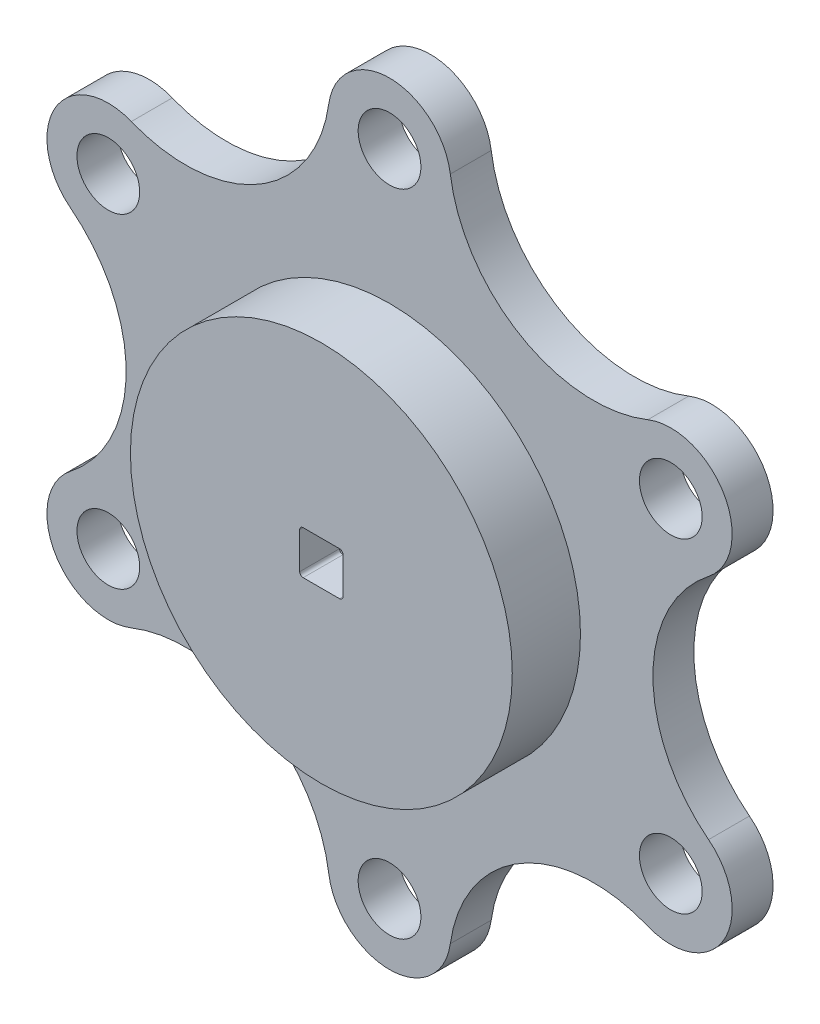
from build123d import *

# Parameters (mm, degrees)
SKETCH1_R           = 2.3
BOSS_EXTRUDE1_DEPTH = 3
SKETCH2_R           = 14
BOSS_EXTRUDE2_DEPTH = 5
CUT_EXTRUDE1_REACH  = 40.688
SKETCH3_W           = 3.175
SKETCH3_H           = 3.175
SKETCH3_3_R         = 5.08
SKETCH3_3_W         = 6.35
SKETCH3_3_H         = 6.35
SKETCH3_3_W_2       = 3.175
SKETCH3_3_H_2       = 3.175
CUT_EXTRUDE2_DEPTH  = 1.27
CUT_EXTRUDE3_START  = -1.27
SKETCH3_4_W         = 6.35
SKETCH3_4_H         = 6.35
SKETCH3_4_W_2       = 3.175
SKETCH3_4_H_2       = 3.175
CUT_EXTRUDE3_DEPTH  = 3.81
FILLET1_R           = 0.254
FILLET2_R           = 0.635


with BuildPart() as part:
    # Sketch1 → Boss-Extrude1 (new body)
    with BuildSketch(Plane.XY):
        with BuildLine():
            ThreePointArc((4.456432387, 24.437168219), (-4.5e-08, 28.3125), (-4.456432399, 24.43716813))
            ThreePointArc((-4.456432399, 24.43716813), (-9.656250022, 16.725115598), (-18.934992245, 16.077967752))
            ThreePointArc((-18.934992245, 16.077967752), (-24.519343502, 14.156251286), (-23.391426978, 8.359202257))
            ThreePointArc((-23.391426978, 8.359202257), (-19.3125, 3.465e-06), (-23.391421517, -8.359197993))
            ThreePointArc((-23.391421517, -8.359197993), (-24.519344633, -14.156249327), (-18.934990017, -16.077966851))
            ThreePointArc((-18.934990017, -16.077966851), (-9.65625113, -16.725114958), (-4.456433088, -24.437163215))
            ThreePointArc((-4.456433088, -24.437163215), (-2.557e-06, -28.3125), (4.456432378, -24.437168281))
            ThreePointArc((4.456432378, -24.437168281), (9.656248045, -16.725116739), (18.934988153, -16.077966097))
            ThreePointArc((18.934988153, -16.077966097), (24.519343112, -14.156251962), (23.391424728, -8.3592005))
            ThreePointArc((23.391424728, -8.3592005), (19.3125, 1.013e-06), (23.391426325, 8.359201747))
            ThreePointArc((23.391426325, 8.359201747), (24.519343744, 14.156250867), (18.934992375, 16.077967805))
            ThreePointArc((18.934992375, 16.077967805), (9.656250044, 16.725115585), (4.456432387, 24.437168219))
        make_face()
        with Locations((0, 23.8125)):
            Circle(SKETCH1_R, mode=Mode.SUBTRACT)
        with Locations((20.622229928, 11.90625)):
            Circle(SKETCH1_R, mode=Mode.SUBTRACT)
        with Locations((-20.622229928, 11.90625)):
            Circle(SKETCH1_R, mode=Mode.SUBTRACT)
        with Locations((20.622229928, -11.90625)):
            Circle(SKETCH1_R, mode=Mode.SUBTRACT)
        with Locations((-20.622229928, -11.90625)):
            Circle(SKETCH1_R, mode=Mode.SUBTRACT)
        with Locations((0, -23.8125)):
            Circle(SKETCH1_R, mode=Mode.SUBTRACT)
    extrude(amount=BOSS_EXTRUDE1_DEPTH)

    # Sketch2 → Boss-Extrude2 (add)
    with BuildSketch(Plane.XY.offset(3)):
        Circle(SKETCH2_R)
    extrude(amount=BOSS_EXTRUDE2_DEPTH)

    # Sketch3 → Cut-Extrude1 (cut, up to next)
    with BuildSketch(Plane(origin=(0, 0, 0), x_dir=(-1, 0, 0), z_dir=(0, 0, -1)), mode=Mode.PRIVATE) as cut_extrude1_sk1:
        Rectangle(SKETCH3_W, SKETCH3_H)
    cut_extrude1_tool1 = extrude(cut_extrude1_sk1.sketch, amount=-CUT_EXTRUDE1_REACH, mode=Mode.PRIVATE) & part.part
    add(cut_extrude1_tool1.solids().sort_by_distance((0, 0, 0))[0], mode=Mode.SUBTRACT)

    # Sketch3<3> → Cut-Extrude2 (cut)
    # profile 1 of 3: a face of its own
    with BuildSketch(Plane(origin=(0, 0, 0), x_dir=(-1, 0, 0), z_dir=(0, 0, -1))):
        Circle(SKETCH3_3_R)
        Rectangle(SKETCH3_3_W, SKETCH3_3_H, mode=Mode.SUBTRACT)
    # profile 2 of 3: a face of its own
    with BuildSketch(Plane(origin=(0, 0, 0), x_dir=(-1, 0, 0), z_dir=(0, 0, -1))):
        Rectangle(SKETCH3_3_W, SKETCH3_3_H)
        Rectangle(SKETCH3_3_W_2, SKETCH3_3_H_2, mode=Mode.SUBTRACT)
    # profile 3 of 3: a face of its own
    with BuildSketch(Plane(origin=(0, 0, 0), x_dir=(-1, 0, 0), z_dir=(0, 0, -1))):
        Rectangle(SKETCH3_3_W_2, SKETCH3_3_H_2)
    extrude(amount=-CUT_EXTRUDE2_DEPTH, mode=Mode.SUBTRACT)

    # Sketch3<4> → Cut-Extrude3 (cut)
    with BuildSketch(Plane(origin=(0, 0, 0), x_dir=(-1, 0, 0), z_dir=(0, 0, -1)).offset(CUT_EXTRUDE3_START)):
        Rectangle(SKETCH3_4_W, SKETCH3_4_H)
        Rectangle(SKETCH3_4_W_2, SKETCH3_4_H_2, mode=Mode.SUBTRACT)
    extrude(amount=-CUT_EXTRUDE3_DEPTH, mode=Mode.SUBTRACT)

    # Fillet1
    fillet1_edges = [part.edges().sort_by_distance(p)[0] for p in [
        (-1.5875, -1.5875, 6.54),
        (1.5875, -1.5875, 6.54),
        (1.5875, 1.5875, 6.54),
        (-1.5875, 1.5875, 6.54),
    ]]
    fillet(fillet1_edges, radius=FILLET1_R)

    # Fillet2
    fillet2_edges = [part.edges().sort_by_distance(p)[0] for p in [
        (3.175, -3.175, 3.175),
        (3.175, 3.175, 3.175),
        (-3.175, 3.175, 3.175),
        (-3.175, -3.175, 3.175),
    ]]
    fillet(fillet2_edges, radius=FILLET2_R)


solid = part.part
